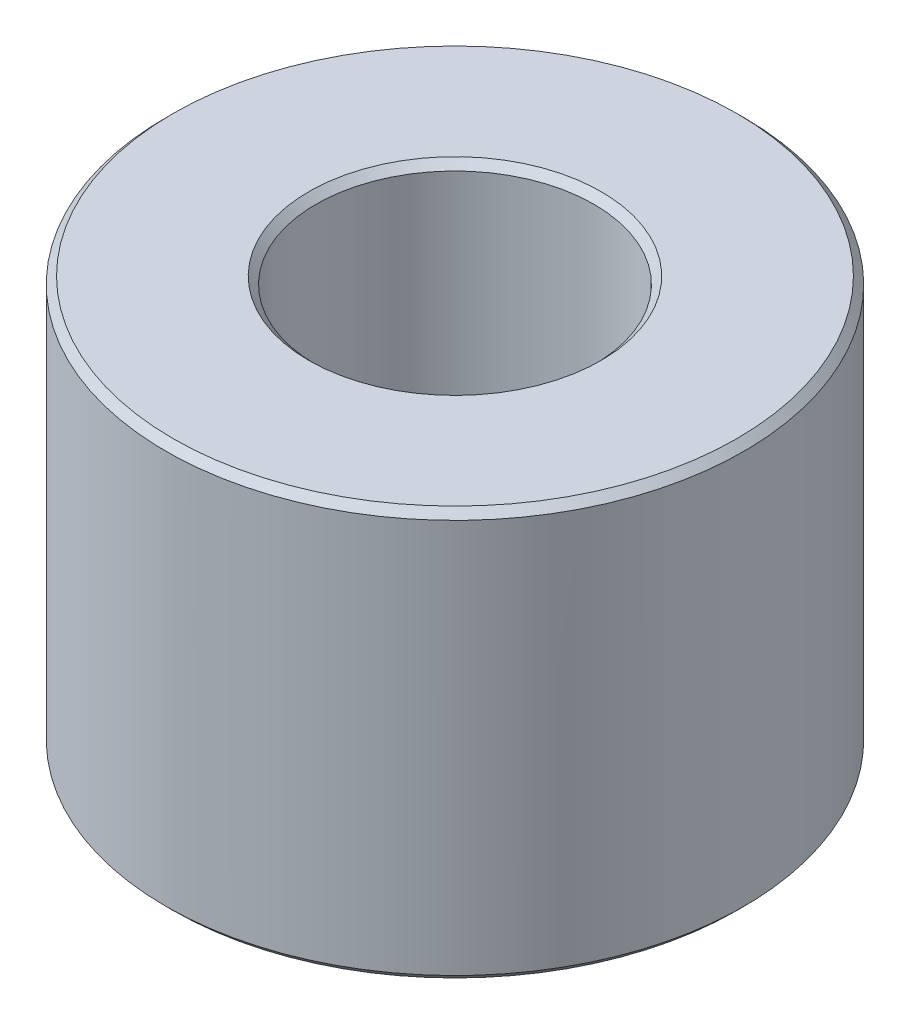
from build123d import *

# Parameters (mm, degrees)
SKETCH1_R           = 55
BOSS_EXTRUDE1_DEPTH = 77.772028153
SKETCH2_R           = 26.443375059
CUT_EXTRUDE1_DEPTH  = 110.993128708
CHAMFER1_SIZE       = 1.382149882


with BuildPart() as part:
    # Sketch1 → Boss-Extrude1 (new body)
    with BuildSketch(Plane(origin=(0, 0, 0), x_dir=(1, 0, 0), z_dir=(0, 1, 0))):
        Circle(SKETCH1_R)
    extrude(amount=BOSS_EXTRUDE1_DEPTH)

    # Sketch2 → Cut-Extrude1 (cut, through all)
    with BuildSketch(Plane(origin=(0, 0, 0), x_dir=(1, 0, 0), z_dir=(0, 1, 0))):
        Circle(SKETCH2_R)
    extrude(amount=CUT_EXTRUDE1_DEPTH, mode=Mode.SUBTRACT)

    # Chamfer1
    chamfer1_edges = [part.edges().sort_by_distance(p)[0] for p in [
        (-26.443375059, 77.772028153, 0),
        (-26.443375059, 0, 0),
        (-55, 0, 0),
        (-55, 77.772028153, 0),
    ]]
    chamfer(chamfer1_edges, length=CHAMFER1_SIZE)


solid = part.part
